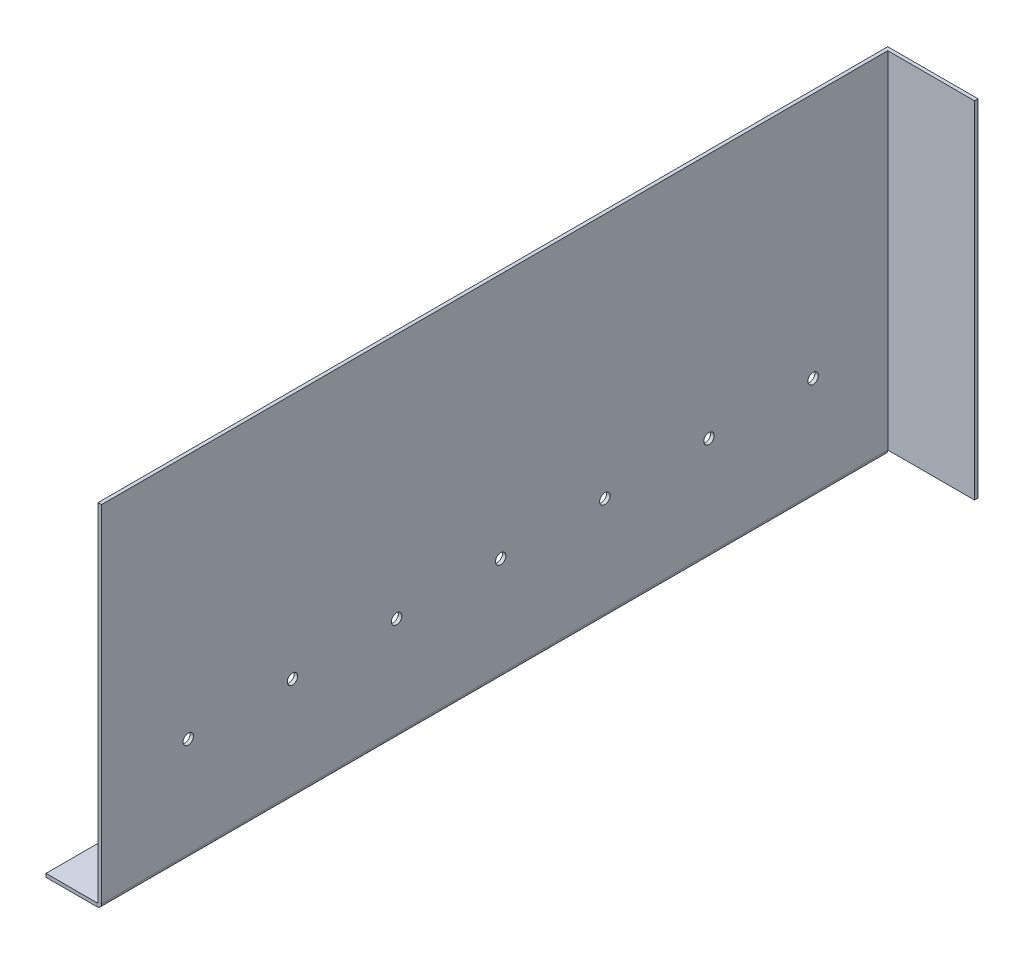
from build123d import *

# Parameters (mm, degrees)
BASE_FLANGE1_DEPTH      = 550
SKETCH10_R              = 3
CUT_EXTRUDE2_DEPTH      = 10
CUT_EXTRUDE3_DEPTH      = 587.003412959
CUT_EXTRUDE3_DEPTH_BACK = 587.003412959
SKETCH15_W              = 2
SKETCH15_H              = 199.2634
BOSS_EXTRUDE2_DEPTH     = 50
SKETCH16_W              = 32
SKETCH16_H              = 2
CUT_EXTRUDE4_DEPTH      = 2.7366


# Sheet-metal steps are written as plain solids
with BuildPart() as part:
    # Sketch1 → Base-Flange1 (new body)
    with BuildSketch(Plane.XY):
        with BuildLine():
            Line((0, 0), (29.2634, 0))
            ThreePointArc((29.2634, 0), (29.784254855, 0.215745145), (30, 0.7366))
            Line((30, 0.7366), (30, 200))
            Line((30, 200), (32, 200))
            Line((32, 200), (32, 0.7366))
            ThreePointArc((32, 0.7366), (31.198468417, -1.198468417), (29.2634, -2))
            Line((29.2634, -2), (0, -2))
            Line((0, -2), (0, 0))
        make_face()
    extrude(amount=BASE_FLANGE1_DEPTH)

    # Sketch10 → Cut-Extrude2 (cut)
    with BuildSketch(Plane(origin=(32, 0, 0), x_dir=(0, 0, -1), z_dir=(1, 0, 0))):
        with Locations((-500, 58)):
            Circle(SKETCH10_R)
        with Locations((-440, 58)):
            Circle(SKETCH10_R)
        with Locations((-380, 58)):
            Circle(SKETCH10_R)
        with Locations((-320, 58)):
            Circle(SKETCH10_R)
        with Locations((-260, 58)):
            Circle(SKETCH10_R)
        with Locations((-200, 58)):
            Circle(SKETCH10_R)
        with Locations((-140, 58)):
            Circle(SKETCH10_R)
    extrude(amount=-CUT_EXTRUDE2_DEPTH, mode=Mode.SUBTRACT)

    # Sketch11 → Cut-Extrude3 (cut, two sides: drawn at the far end of the back side and taken through both)
    with BuildSketch(Plane.ZY.offset(-30).offset(-CUT_EXTRUDE3_DEPTH_BACK)):
        Polygon((0, 200), (95, 200), (95, 0.7366), (95, -11.499359117), (0, -11.499359117), (0, 0.7366), align=None)
    extrude(amount=CUT_EXTRUDE3_DEPTH + CUT_EXTRUDE3_DEPTH_BACK, mode=Mode.SUBTRACT)

    # Sketch15 → Boss-Extrude2 (add)
    with BuildSketch(Plane(origin=(32, 0, 0), x_dir=(0, 0, -1), z_dir=(1, 0, 0))):
        with Locations((-96, 100.3683)):
            Rectangle(SKETCH15_W, SKETCH15_H)
    extrude(amount=BOSS_EXTRUDE2_DEPTH)

    # Sketch16 → Cut-Extrude4 (cut)
    with BuildSketch(Plane(origin=(0, -2, 0), x_dir=(-1, 0, 0), z_dir=(0, -1, 0))):
        with Locations((-16, -96)):
            Rectangle(SKETCH16_W, SKETCH16_H)
    extrude(amount=-CUT_EXTRUDE4_DEPTH, mode=Mode.SUBTRACT)


solid = part.part
